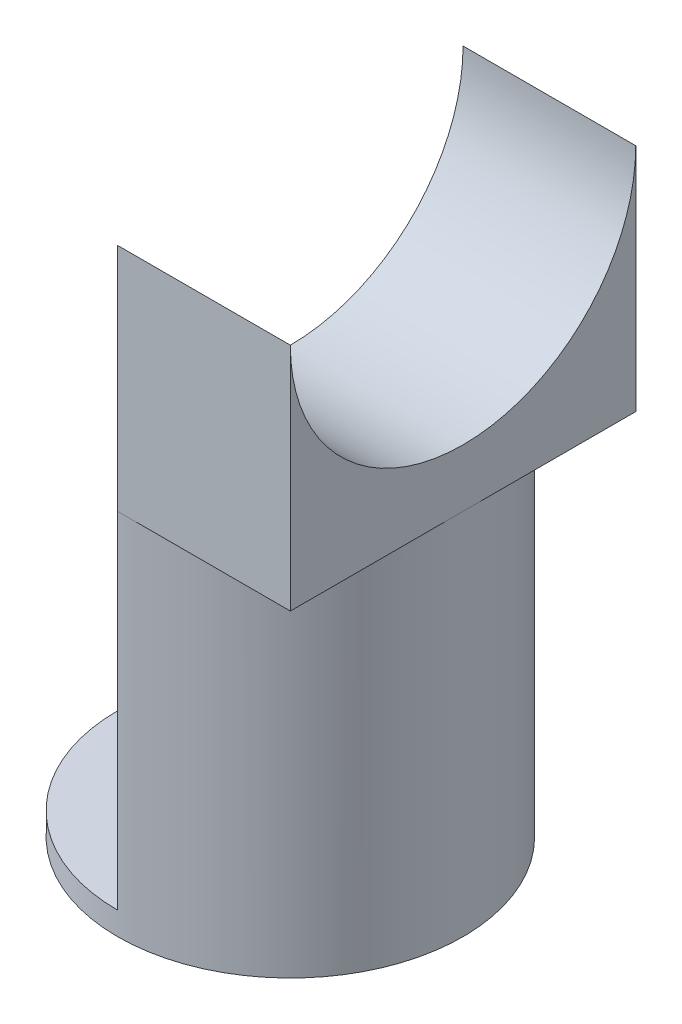
from build123d import *

# Parameters (mm, degrees)
SKETCH1_R           = 75
BOSS_EXTRUDE1_DEPTH = 10
BOSS_EXTRUDE5_DEPTH = 150
SKETCH13_W          = 75
SKETCH13_H          = 150
BOSS_EXTRUDE6_DEPTH = 100
SKETCH14_R          = 75
CUT_EXTRUDE5_DEPTH  = 100


with BuildPart() as part:
    # Sketch1 → Boss-Extrude1 (new body)
    with BuildSketch(Plane(origin=(0, 0, 0), x_dir=(1, 0, 0), z_dir=(0, 1, 0))):
        Circle(SKETCH1_R)
    extrude(amount=BOSS_EXTRUDE1_DEPTH)

    # Sketch12 → Boss-Extrude5 (add)
    with BuildSketch(Plane(origin=(0, 10, 0), x_dir=(1, 0, 0), z_dir=(0, 1, 0))):
        with BuildLine():
            Line((0, 75), (0, 0))
            Line((0, 0), (0, -75))
            ThreePointArc((0, -75), (75, 0), (0, 75))
        make_face()
    extrude(amount=BOSS_EXTRUDE5_DEPTH)

    # Sketch13 → Boss-Extrude6 (add)
    with BuildSketch(Plane(origin=(0, 160, 0), x_dir=(1, 0, 0), z_dir=(0, 1, 0))):
        with Locations((37.5, 0)):
            Rectangle(SKETCH13_W, SKETCH13_H)
    extrude(amount=BOSS_EXTRUDE6_DEPTH)

    # Sketch14 → Cut-Extrude5 (cut)
    with BuildSketch(Plane.ZY):
        with Locations((0, 260)):
            Circle(SKETCH14_R)
    extrude(amount=-CUT_EXTRUDE5_DEPTH, mode=Mode.SUBTRACT)


solid = part.part
